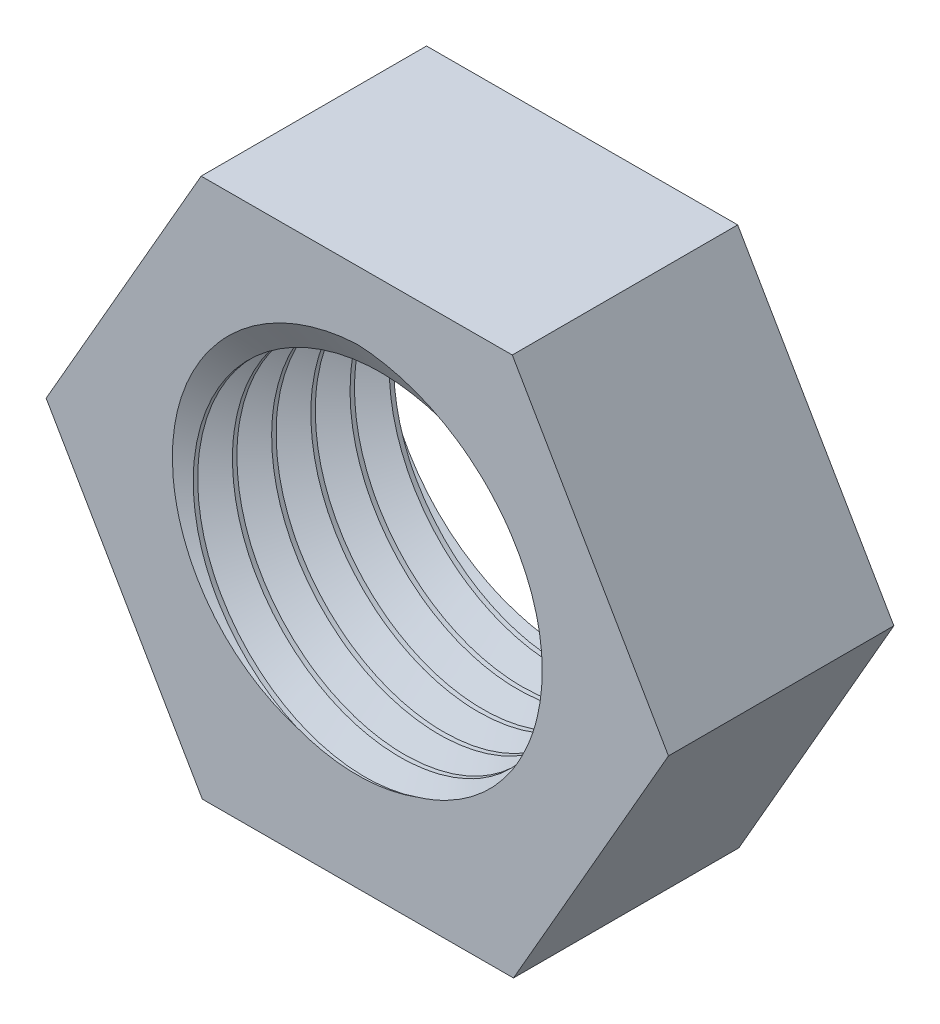
from build123d import *

# Parameters (mm, degrees)
SKETCH1_R           = 1.75
BOSS_EXTRUDE1_DEPTH = 2.3
CUT_SWEEP2_PITCH    = 0.4


with BuildPart() as part:
    # Sketch1 → Boss-Extrude1 (new body)
    with BuildSketch(Plane.XY):
        Polygon((1.593747789, -2.746507112), (3.175418826, 0.006972516), (1.581671036, 2.753479629), (-1.593747789, 2.746507112), (-3.175418826, -0.006972516), (-1.581671036, -2.753479629), align=None)
        Circle(SKETCH1_R, mode=Mode.SUBTRACT)
    extrude(amount=BOSS_EXTRUDE1_DEPTH)

    # Cut-Sweep2: arcs per turn and ends read off the stored shape
    # Cut-Sweep2: the profile of Sketch9 screwed along a right-hand helix through 10 turns, 6 arcs to a turn; built about Z, then put on its axis
    cut_sweep2_z = Axis((0, 0, 0), (0, 0, 1))
    cut_sweep2_corners = [(0, -2.056972516, -0.5), (0, -1.606972516, -0.240192379), (0, -1.606972516, -0.759807621)]
    with BuildLine(mode=Mode.PRIVATE) as cut_sweep2_profile:
        Line(cut_sweep2_corners[0], cut_sweep2_corners[1])
        Line(cut_sweep2_corners[1], cut_sweep2_corners[2])
        Line(cut_sweep2_corners[2], cut_sweep2_corners[0])
    cut_sweep2_cap = Face(cut_sweep2_profile.wire())
    cut_sweep2_turn_angles = [0, 30, 60, 90, 120, 150, 180, 210, 240, 270, 300, 330, 360]
    cut_sweep2_turn_weights = [1, 0.8660254037844387, 1, 0.8660254037844387, 1, 0.8660254037844387, 1, 0.8660254037844387, 1, 0.8660254037844387, 1, 0.8660254037844387, 1]
    cut_sweep2_turn_rails = [Edge.make_bspline([Vector(p[0], p[1], 0).rotate(cut_sweep2_z, cut_sweep2_turn_angles[k]) / cut_sweep2_turn_weights[k] + Vector(0, 0, p[2] + CUT_SWEEP2_PITCH * cut_sweep2_turn_angles[k] / 360) for k in range(13)], [0, 0, 0, 1, 1, 2, 2, 3, 3, 4, 4, 5, 5, 6, 6, 6], 2, cut_sweep2_turn_weights) for p in cut_sweep2_corners]
    cut_sweep2_turn_sides = [Face.make_surface_from_curves(cut_sweep2_turn_rails[p[0]], cut_sweep2_turn_rails[p[1]]) for p in [(0, 1), (1, 2), (2, 0)]]
    cut_sweep2 = Plane(origin=(0, 0, 0), x_dir=(-1, 0, 0), z_dir=(0, 0, 1)) * Solid(Shell([*[p.moved(Location((0, 0, CUT_SWEEP2_PITCH * i))) for i in range(10) for p in cut_sweep2_turn_sides], cut_sweep2_cap, cut_sweep2_cap.rotate(cut_sweep2_z, 3600).moved(Location((0, 0, CUT_SWEEP2_PITCH * 3600 / 360)))]))
    add(cut_sweep2, mode=Mode.SUBTRACT)


solid = part.part
